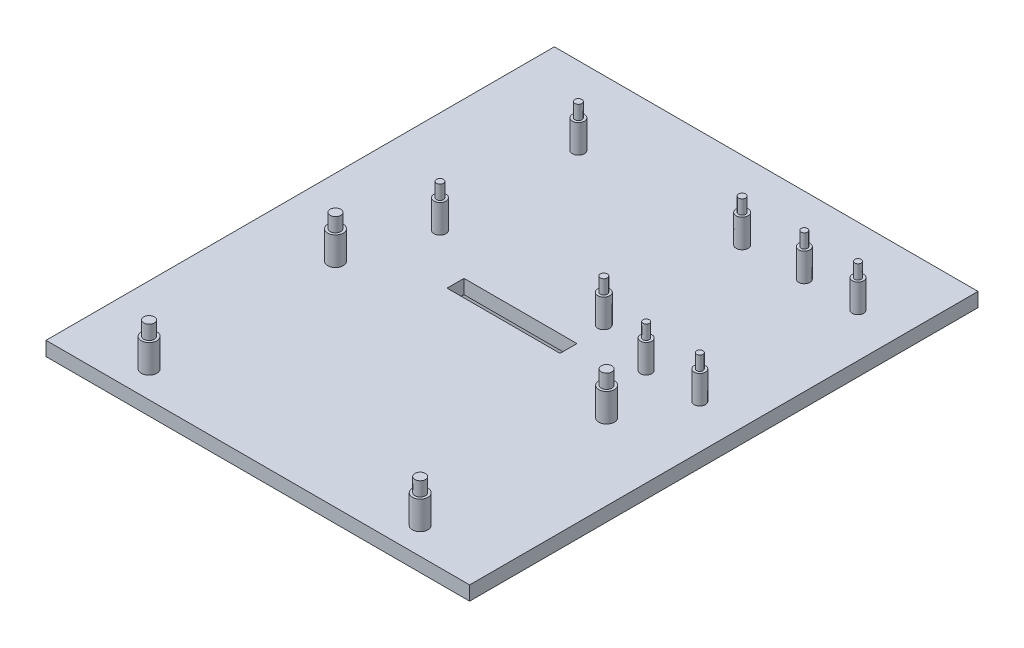
from build123d import *

# Parameters (mm, degrees)
ESQUISSE1_W             = 62
ESQUISSE1_H             = 12
ESQUISSE1_W_2           = 58
ESQUISSE1_H_2           = 8
BOSS_EXTRU_1_DEPTH      = 15
ESQUISSE2_R             = 3.175
ENL_V_MAT_EXTRU_1_DEPTH = 37.469165058
ESQUISSE3_W             = 150
ESQUISSE3_H             = 180
BOSS_EXTRU_2_DEPTH      = 5
ENL_V_MAT_EXTRU_3_REACH = 120.11
ESQUISSE6_W             = 40
ESQUISSE6_H             = 6
ESQUISSE11_R            = 2.75
BOSS_EXTRU_3_DEPTH      = 10
ESQUISSE13_R            = 2
BOSS_EXTRU_4_DEPTH      = 10
ESQUISSE12_R            = 2.125
BOSS_EXTRU_5_DEPTH      = 10
ESQUISSE10_R            = 1.875
BOSS_EXTRU_6_DEPTH      = 15
ESQUISSE9_R             = 1.125
BOSS_EXTRU_7_DEPTH      = 15
ESQUISSE8_R             = 1.25
BOSS_EXTRU_8_DEPTH      = 15


with BuildPart() as part:
    # Esquisse1 → Boss.-Extru.1 (new body)
    with BuildSketch(Plane(origin=(0, 0, 0), x_dir=(1, 0, 0), z_dir=(0, 1, 0))):
        Rectangle(ESQUISSE1_W, ESQUISSE1_H)
        Rectangle(ESQUISSE1_W_2, ESQUISSE1_H_2, mode=Mode.SUBTRACT)
    extrude(amount=BOSS_EXTRU_1_DEPTH)

    # Esquisse2 → Enlèv. mat.-Extru.1 (cut, through all)
    with BuildSketch(Plane.XY.offset(6)):
        with Locations((0, 9)):
            Circle(ESQUISSE2_R)
    extrude(amount=-ENL_V_MAT_EXTRU_1_DEPTH, mode=Mode.SUBTRACT)

    # Esquisse3 → Boss.-Extru.2 (add)
    with BuildSketch(Plane(origin=(0, 15, 0), x_dir=(1, 0, 0), z_dir=(0, 1, 0))):
        Rectangle(ESQUISSE3_W, ESQUISSE3_H)
    extrude(amount=BOSS_EXTRU_2_DEPTH)

    # Esquisse6 → Enlèv. mat.-Extru.3 (cut, up to next)
    with BuildSketch(Plane(origin=(0, 15, 0), x_dir=(-1, 0, 0), z_dir=(0, -1, 0)), mode=Mode.PRIVATE) as enl_v_mat_extru_3_sk1:
        Rectangle(ESQUISSE6_W, ESQUISSE6_H)
    enl_v_mat_extru_3_tool1 = extrude(enl_v_mat_extru_3_sk1.sketch, amount=-ENL_V_MAT_EXTRU_3_REACH, mode=Mode.PRIVATE) & part.part
    add(enl_v_mat_extru_3_tool1.solids().sort_by_distance((0, 15, 0))[0], mode=Mode.SUBTRACT)

    # Esquisse11 → Boss.-Extru.3 (add)
    with BuildSketch(Plane(origin=(0, 20, 0), x_dir=(1, 0, 0), z_dir=(0, 1, 0))):
        with Locations((-48, -14.5)):
            Circle(ESQUISSE11_R)
        with Locations((-48, -80.5)):
            Circle(ESQUISSE11_R)
        with Locations((48, -14.5)):
            Circle(ESQUISSE11_R)
        with Locations((48, -80.5)):
            Circle(ESQUISSE11_R)
    extrude(amount=BOSS_EXTRU_3_DEPTH)

    # Esquisse13 → Boss.-Extru.4 (add)
    with BuildSketch(Plane(origin=(0, 20, 0), x_dir=(1, 0, 0), z_dir=(0, 1, 0))):
        with Locations((59.5, 7)):
            Circle(ESQUISSE13_R)
        with Locations((59.5, 63)):
            Circle(ESQUISSE13_R)
        with Locations((40.5, 7)):
            Circle(ESQUISSE13_R)
        with Locations((40.5, 63)):
            Circle(ESQUISSE13_R)
    extrude(amount=BOSS_EXTRU_4_DEPTH)

    # Esquisse12 → Boss.-Extru.5 (add)
    with BuildSketch(Plane(origin=(0, 20, 0), x_dir=(1, 0, 0), z_dir=(0, 1, 0))):
        with Locations((19, 62.5)):
            Circle(ESQUISSE12_R)
        with Locations((19, 13.5)):
            Circle(ESQUISSE12_R)
        with Locations((-39, 62.5)):
            Circle(ESQUISSE12_R)
        with Locations((-39, 13.5)):
            Circle(ESQUISSE12_R)
    extrude(amount=BOSS_EXTRU_5_DEPTH)

    # Esquisse10 → Boss.-Extru.6 (add)
    with BuildSketch(Plane(origin=(0, 20, 0), x_dir=(1, 0, 0), z_dir=(0, 1, 0))):
        with Locations((-48, -14.5)):
            Circle(ESQUISSE10_R)
        with Locations((48, -14.5)):
            Circle(ESQUISSE10_R)
        with Locations((-48, -80.5)):
            Circle(ESQUISSE10_R)
        with Locations((48, -80.5)):
            Circle(ESQUISSE10_R)
    extrude(amount=BOSS_EXTRU_6_DEPTH)

    # Esquisse9 → Boss.-Extru.7 (add)
    with BuildSketch(Plane(origin=(0, 20, 0), x_dir=(1, 0, 0), z_dir=(0, 1, 0))):
        with Locations((59.5, 63)):
            Circle(ESQUISSE9_R)
        with Locations((40.5, 63)):
            Circle(ESQUISSE9_R)
        with Locations((59.5, 7)):
            Circle(ESQUISSE9_R)
        with Locations((40.5, 7)):
            Circle(ESQUISSE9_R)
    extrude(amount=BOSS_EXTRU_7_DEPTH)

    # Esquisse8 → Boss.-Extru.8 (add)
    with BuildSketch(Plane(origin=(0, 20, 0), x_dir=(1, 0, 0), z_dir=(0, 1, 0))):
        with Locations((19, 62.5)):
            Circle(ESQUISSE8_R)
        with Locations((19, 13.5)):
            Circle(ESQUISSE8_R)
        with Locations((-39, 62.5)):
            Circle(ESQUISSE8_R)
        with Locations((-39, 13.5)):
            Circle(ESQUISSE8_R)
    extrude(amount=BOSS_EXTRU_8_DEPTH)


solid = part.part
